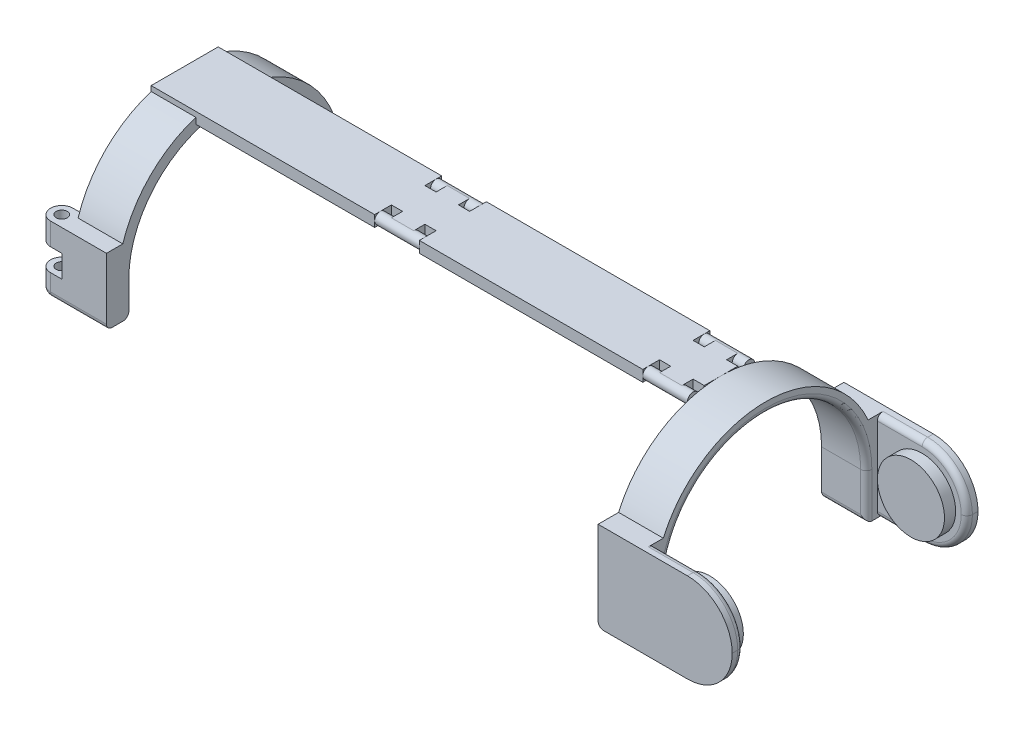
from build123d import *

# Parameters (mm, degrees)
BOSS_EXTRUDE1_DEPTH  = 20
SKETCH3_W            = 10
SKETCH3_H            = 40
BOSS_EXTRUDE2_DEPTH  = 60
SKETCH4_W            = 40
SKETCH4_H            = 40
CUT_EXTRUDE1_DEPTH   = 5
SKETCH5_R            = 15
BOSS_EXTRUDE3_DEPTH  = 5
SKETCH6_W            = 7.5
SKETCH6_H            = 5
BOSS_EXTRUDE4_DEPTH  = 20
SKETCH7_W            = 10
SKETCH7_H            = 5
BOSS_EXTRUDE5_DEPTH  = 5
SKETCH9_R            = 2.5
BOSS_EXTRUDE6_DEPTH  = 20
FILLET2_R            = 2.5
FILLET3_R            = 20
FILLET4_R            = 2.5
SKETCH10_W           = 30
SKETCH10_H           = 5
BOSS_EXTRUDE9_DEPTH  = 100
SKETCH12_W           = 7.5
SKETCH12_H           = 5
BOSS_EXTRUDE10_DEPTH = 20
SKETCH13_W           = 10
SKETCH13_H           = 5
BOSS_EXTRUDE11_DEPTH = 5
BOSS_EXTRUDE12_START = -15
SKETCH14_R           = 2.5
BOSS_EXTRUDE12_DEPTH = 20
SKETCH15_W           = 30
SKETCH15_H           = 5
BOSS_EXTRUDE13_DEPTH = 100
BOSS_EXTRUDE14_DEPTH = 20
BOSS_EXTRUDE15_START = -20
SKETCH17_W           = 10
SKETCH17_H           = 15
BOSS_EXTRUDE15_DEPTH = 30
CUT_EXTRUDE2_REACH   = 279.669
SKETCH18_W           = 10
SKETCH18_H           = 5
SKETCH19_R           = 2.5
CUT_EXTRUDE3_DEPTH   = 10
FILLET5_R            = 5
FILLET6_R            = 2.5


# Some blends are built 0.0001 mm under size
with BuildPart() as part:
    # Sketch1 → Boss-Extrude1 (new body)
    with BuildSketch(Plane(origin=(0, 0, 0), x_dir=(0, 0, -1), z_dir=(1, 0, 0))):
        with BuildLine():
            Line((-45, 0), (-50, 0))
            ThreePointArc((-50, 0), (0, 50), (50, 0))
            Line((50, 0), (45, 0))
            ThreePointArc((45, 0), (0, 45), (-45, 0))
        make_face()
    extrude(amount=BOSS_EXTRUDE1_DEPTH)

    # Sketch3 → Boss-Extrude2 (add)
    with BuildSketch(Plane(origin=(0, 0, 0), x_dir=(0, 0, -1), z_dir=(1, 0, 0))):
        with Locations((50, 0)):
            Rectangle(SKETCH3_W, SKETCH3_H)
    boss_extrude2 = extrude(amount=BOSS_EXTRUDE2_DEPTH)

    # Sketch4 → Cut-Extrude1 (cut)
    with BuildSketch(Plane.XY.offset(-45)):
        with Locations((40, 0)):
            Rectangle(SKETCH4_W, SKETCH4_H)
    cut_extrude1 = extrude(amount=-CUT_EXTRUDE1_DEPTH, mode=Mode.SUBTRACT)

    # Sketch5 → Boss-Extrude3 (add)
    with BuildSketch(Plane.XY.offset(-50)):
        with Locations(Location((40, 0, 0), (0, 0, 180))):
            Circle(SKETCH5_R)
    boss_extrude3 = extrude(amount=BOSS_EXTRUDE3_DEPTH)

    # Sketch6 → Boss-Extrude4 (add)
    with BuildSketch(Plane.ZY):
        with Locations((-3.75, 47.5)):
            Rectangle(SKETCH6_W, SKETCH6_H)
    boss_extrude4 = extrude(amount=BOSS_EXTRUDE4_DEPTH)

    # Sketch7 → Boss-Extrude5 (add)
    with BuildSketch(Plane(origin=(0, 0, -7.5), x_dir=(-1, 0, 0), z_dir=(0, 0, -1))):
        with Locations((10, 47.5)):
            Rectangle(SKETCH7_W, SKETCH7_H)
    boss_extrude5 = extrude(amount=BOSS_EXTRUDE5_DEPTH)

    # Sketch9 → Boss-Extrude6 (add)
    with BuildSketch(Plane(origin=(0, 0, 0), x_dir=(0, 0, -1), z_dir=(1, 0, 0))):
        with Locations((12.5, 47.5)):
            Circle(SKETCH9_R)
    boss_extrude6 = extrude(amount=-BOSS_EXTRUDE6_DEPTH)

    # Mirror1: Boss-Extrude2, Cut-Extrude1, Boss-Extrude3, Boss-Extrude4, Boss-Extrude5, Boss-Extrude6 across plane
    add(boss_extrude2.mirror(Plane.XY))
    add(cut_extrude1.mirror(Plane.XY), mode=Mode.SUBTRACT)
    add(boss_extrude3.mirror(Plane.XY))
    add(boss_extrude4.mirror(Plane.XY))
    add(boss_extrude5.mirror(Plane.XY))
    add(boss_extrude6.mirror(Plane.XY))

    # Fillet2
    fillet2_edges = [part.edges().sort_by_distance(p)[0] for p in [
        (20, 45, 0),
        (10, -20, 45),
        (20, -10, 45),
        (0, -20, -50),
        (10, -20, -45),
        (20, -10, -45),
        (0, -20, 50),
    ]]
    fillet(fillet2_edges, radius=FILLET2_R)

    # Fillet3
    fillet3_edges = [part.edges().sort_by_distance(p)[0] for p in [
        (60, -20, -52.5),
        (60, 20, -52.5),
        (60, -20, 52.5),
        (60, 20, 52.5),
    ]]
    fillet(fillet3_edges, radius=FILLET3_R - 0.0001)  # a hair under: the kernel refuses the full size

    # Fillet4
    fillet4_edges = [part.edges().sort_by_distance(p)[0] for p in [
        (30.00005, -20, 50),
        (30.00005, 20, -50),
        (54.142164913, 14.142164913, -50),
        (54.142164913, -14.142164913, -50),
        (30.00005, 20, 50),
        (54.142164913, 14.142164913, 50),
        (54.142164913, -14.142164913, 50),
        (30.00005, -20, -50),
    ]]
    fillet(fillet4_edges, radius=FILLET4_R)

    # Sketch10 → Boss-Extrude9 (add)
    with BuildSketch(Plane.ZY.offset(20)):
        with Locations((0, 47.5)):
            Rectangle(SKETCH10_W, SKETCH10_H)
    extrude(amount=BOSS_EXTRUDE9_DEPTH)

    # Sketch12 → Boss-Extrude10 (add)
    with BuildSketch(Plane.ZY.offset(120)):
        with Locations((-3.75, 47.5)):
            Rectangle(SKETCH12_W, SKETCH12_H)
    boss_extrude10 = extrude(amount=BOSS_EXTRUDE10_DEPTH)

    # Sketch13 → Boss-Extrude11 (add)
    with BuildSketch(Plane(origin=(0, 0, -7.5), x_dir=(-1, 0, 0), z_dir=(0, 0, -1))):
        with Locations((130, 47.5)):
            Rectangle(SKETCH13_W, SKETCH13_H)
    boss_extrude11 = extrude(amount=BOSS_EXTRUDE11_DEPTH)

    # Sketch14 → Boss-Extrude12 (add)
    with BuildSketch(Plane.ZY.offset(135).offset(BOSS_EXTRUDE12_START)):
        with Locations(Location((-12.5, 47.5, 0), (0, 0, 180))):
            Circle(SKETCH14_R)
    boss_extrude12 = extrude(amount=BOSS_EXTRUDE12_DEPTH)

    # Mirror2: Boss-Extrude10, Boss-Extrude11, Boss-Extrude12 across plane
    add(boss_extrude10.mirror(Plane(origin=(-140, 50, 0), x_dir=(1, 0, 0), z_dir=(0, 0, -1))))
    add(boss_extrude11.mirror(Plane(origin=(-140, 50, 0), x_dir=(1, 0, 0), z_dir=(0, 0, -1))))
    add(boss_extrude12.mirror(Plane(origin=(-140, 50, 0), x_dir=(1, 0, 0), z_dir=(0, 0, -1))))

    # Sketch15 → Boss-Extrude13 (add)
    with BuildSketch(Plane.ZY.offset(140)):
        with Locations((0, 47.5)):
            Rectangle(SKETCH15_W, SKETCH15_H)
    extrude(amount=BOSS_EXTRUDE13_DEPTH)

    # Sketch16 → Boss-Extrude14 (add)
    with BuildSketch(Plane.ZY.offset(240)):
        with BuildLine():
            Line((50, 0), (45, 0))
            ThreePointArc((45, 0), (0, 45), (-45, 0))
            Line((-45, 0), (-50, 0))
            ThreePointArc((-50, 0), (0, 50), (50, 0))
        make_face()
    extrude(amount=-BOSS_EXTRUDE14_DEPTH)

    # Sketch17 → Boss-Extrude15 (add)
    with BuildSketch(Plane.ZY.offset(240).offset(BOSS_EXTRUDE15_START)):
        with Locations((50, 7.5)):
            Rectangle(SKETCH17_W, SKETCH17_H)
    boss_extrude15 = extrude(amount=BOSS_EXTRUDE15_DEPTH)

    # Sketch18 → Cut-Extrude2 (cut, up to next)
    with BuildSketch(Plane.XY.offset(55), mode=Mode.PRIVATE) as cut_extrude2_sk1:
        with Locations((-245, 2.5)):
            Rectangle(SKETCH18_W, SKETCH18_H)
    cut_extrude2_tool1 = extrude(cut_extrude2_sk1.sketch, amount=-CUT_EXTRUDE2_REACH, mode=Mode.PRIVATE) & part.part
    cut_extrude2 = cut_extrude2_tool1.solids().sort_by_distance((-245, 2.5, 55))[0]
    add(cut_extrude2, mode=Mode.SUBTRACT)

    # Sketch19 → Cut-Extrude3 (cut)
    with BuildSketch(Plane.XZ.offset(-5)):
        with Locations(Location((-245, 50, 0), (0, 0, 270))):
            Circle(SKETCH19_R)
    cut_extrude3 = extrude(amount=-CUT_EXTRUDE3_DEPTH, mode=Mode.SUBTRACT)

    # Mirror3: Boss-Extrude15, Cut-Extrude2, Cut-Extrude3 across Top Plane
    add(boss_extrude15.mirror(Plane(origin=(0, 0, 0), x_dir=(1, 0, 0), z_dir=(0, 1, 0))))
    add(cut_extrude2.mirror(Plane(origin=(0, 0, 0), x_dir=(1, 0, 0), z_dir=(0, 1, 0))), mode=Mode.SUBTRACT)
    add(cut_extrude3.mirror(Plane(origin=(0, 0, 0), x_dir=(1, 0, 0), z_dir=(0, 1, 0))), mode=Mode.SUBTRACT)

    # Fillet5
    fillet5_edges = [part.edges().sort_by_distance(p)[0] for p in [
        (-250, -10, 45),
        (-250, -10, 55),
        (-250, 10, 55),
        (-250, 10, 45),
    ]]
    fillet(fillet5_edges, radius=FILLET5_R - 0.0001)  # a hair under: the kernel refuses the full size

    # Fillet6
    # the kernel refuses this fillet: 2.5 mm, written as the material it takes off along each edge
    with BuildSketch(Plane(origin=(-246.581228163, 0, -50), x_dir=(0, 0, 1), z_dir=(1, 0, 0))) as fillet6_piece_1:
        with BuildLine():
            CenterArc((2.565835097, -2.5), FILLET6_R, 90, 93.01696131)
            ThreePointArc((0.069300103, -2.631578947), (0.017328028, -1.316245633), (0, 0))
            Line((0, 0), (2.565835097, 0))
        make_face()
    extrude(amount=33.162456325, mode=Mode.SUBTRACT)
    with BuildSketch(Plane(origin=(-246.085412256, 0, -45), x_dir=(0, 0.9996534394348647, 0.026324912650289762), z_dir=(1, 0, 0))) as fillet6_piece_2:
        with BuildLine():
            CenterArc((2.43505442, -2.499133599), FILLET6_R, 91.508480655, 86.98303869)
            Line((-0.064079178, -2.433321317), (0, 0))
            ThreePointArc((0, 0), (1.184621069, -0.015595225), (2.369242139, 0))
        make_face()
    extrude(amount=32.170824513, mode=Mode.SUBTRACT)
    with BuildSketch(Plane(origin=(-213.75, -15, 45), x_dir=(0, 0, 1), z_dir=(-1, 0, 0)), Plane(origin=(-213.75, -15, 55), x_dir=(0, 1, 0), z_dir=(-1, 0, 0))) as fillet6_piece_3:
        with BuildLine():
            CenterArc((FILLET6_R, FILLET6_R), FILLET6_R, 180, 90)
            Line((0, FILLET6_R), (0, 0))
            Line((0, 0), (FILLET6_R, 0))
        make_face()
    extrude(amount=31.2501, mode=Mode.SUBTRACT)
    with BuildSketch(Plane(origin=(-245.0001, -15, 50.0001), x_dir=(0, 0, 1), z_dir=(1, 0, 0))) as fillet6_piece_4:
        with BuildLine():
            CenterArc((4.9999 - FILLET6_R, -FILLET6_R), FILLET6_R, 0, 90)
            Line((4.9999, -FILLET6_R), (4.9999, 0))
            Line((4.9999, 0), (4.9999 - FILLET6_R, 0))
        make_face()
    revolve(axis=Axis((-245.0001, -15, 50.0001), (0, -1, 0)), revolution_arc=90, mode=Mode.SUBTRACT)
    with BuildSketch(Plane(origin=(-245.0001, -15, 49.9999), x_dir=(0, 0, -1), z_dir=(1, 0, 0))) as fillet6_piece_5:
        with BuildLine():
            CenterArc((4.9999 - FILLET6_R, FILLET6_R), FILLET6_R, 270, 90)
            Line((4.9999, FILLET6_R), (4.9999, 0))
            Line((4.9999, 0), (4.9999 - FILLET6_R, 0))
        make_face()
    revolve(axis=Axis((-245.0001, -15, 49.9999), (0, 1, 0)), revolution_arc=90, mode=Mode.SUBTRACT)
    with BuildSketch(Plane(origin=(-250, -15, 50.0001), x_dir=(1, 0, 0), z_dir=(0, 0, -1))) as fillet6_piece_6:
        with BuildLine():
            CenterArc((FILLET6_R, -FILLET6_R), FILLET6_R, 90, 90)
            Line((0, -FILLET6_R), (0, 0))
            Line((0, 0), (FILLET6_R, 0))
        make_face()
    extrude(amount=0.0002, mode=Mode.SUBTRACT)


solid = part.part
